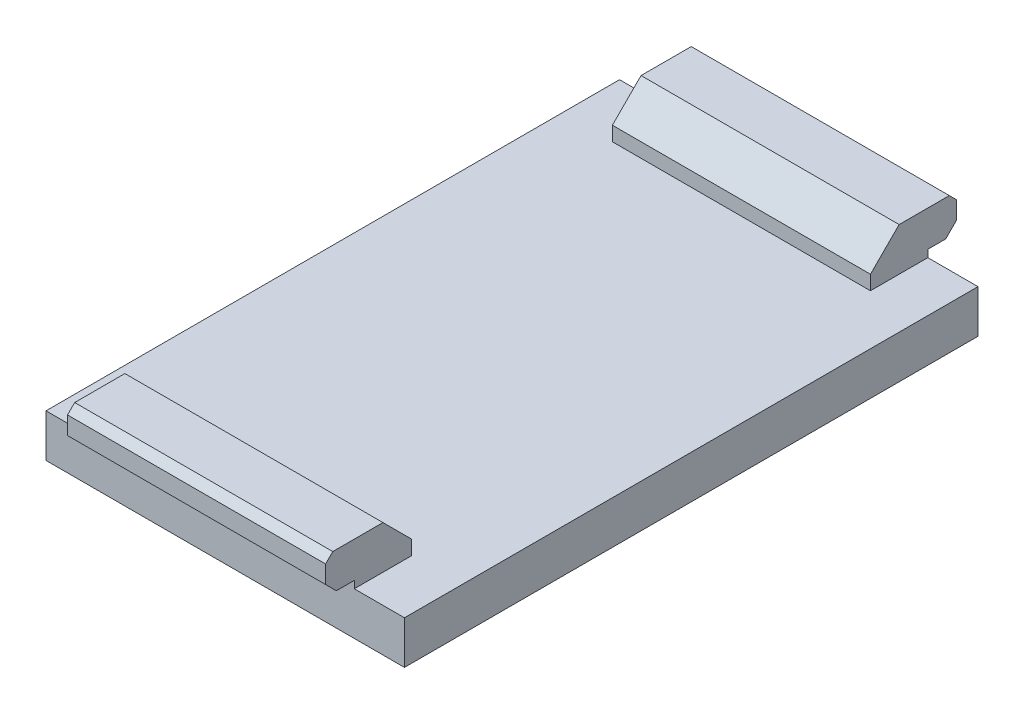
from build123d import *

# Parameters (mm, degrees)
SKETCH_1_W      = 25
SKETCH_1_H      = 3
EXTRUDE_1_DEPTH = 20
SKETCH_2_W      = 18
SKETCH_2_H      = 4
EXTRUDE_2_DEPTH = 3
EXTRUDE_3_DEPTH = 2
CHAMFER_1_SIZE  = 0.75
CHAMFER_2_SIZE  = 0.5
CHAMFER_3_SIZE  = 2


with BuildPart() as part:
    # Эскиз1 → Бобышка-Вытянуть1 (new body)
    with BuildSketch(Plane.XY):
        with Locations((-4.579529598, 16.89)):
            Rectangle(SKETCH_1_W, SKETCH_1_H)
    extrude(amount=EXTRUDE_1_DEPTH)

    # Эскиз2 → Бобышка-Вытянуть2 (add)
    with BuildSketch(Plane(origin=(0, 18.39, 0), x_dir=(1, 0, 0), z_dir=(0, 1, 0))):
        with Locations((-4.579529598, -2)):
            Rectangle(SKETCH_2_W, SKETCH_2_H)
    extrude(amount=EXTRUDE_2_DEPTH)

    # Эскиз3 → Бобышка-Вытянуть3 (add)
    with BuildSketch(Plane(origin=(0, 0, 0), x_dir=(-1, 0, 0), z_dir=(0, 0, -1))):
        Polygon((-4.420470402, 21.39), (13.579529598, 21.39), (13.579529598, 19.89), (13.579529598, 18.896471803), (-4.420470402, 18.896471803), (-4.420470402, 19.89), align=None)
    extrude(amount=EXTRUDE_3_DEPTH)

    # Фаска1
    chamfer_1_edges = [part.edges().sort_by_distance(p)[0] for p in [
        (-4.579529598, 18.896471803, -2),
    ]]
    chamfer(chamfer_1_edges, length=CHAMFER_1_SIZE)

    # Фаска2
    chamfer_2_edges = [part.edges().sort_by_distance(p)[0] for p in [
        (-4.579529598, 21.39, -2),
    ]]
    chamfer(chamfer_2_edges, length=CHAMFER_2_SIZE)

    # Фаска3
    chamfer_3_edges = [part.edges().sort_by_distance(p)[0] for p in [
        (-4.579529598, 21.39, 4),
    ]]
    chamfer(chamfer_3_edges, length=CHAMFER_3_SIZE)

    # Зеркальное отражение1: part across plane


with BuildPart() as part_1:
    add(part.part)
    add(part.part.mirror(Plane.XY.offset(20)))


solid = part_1.part
